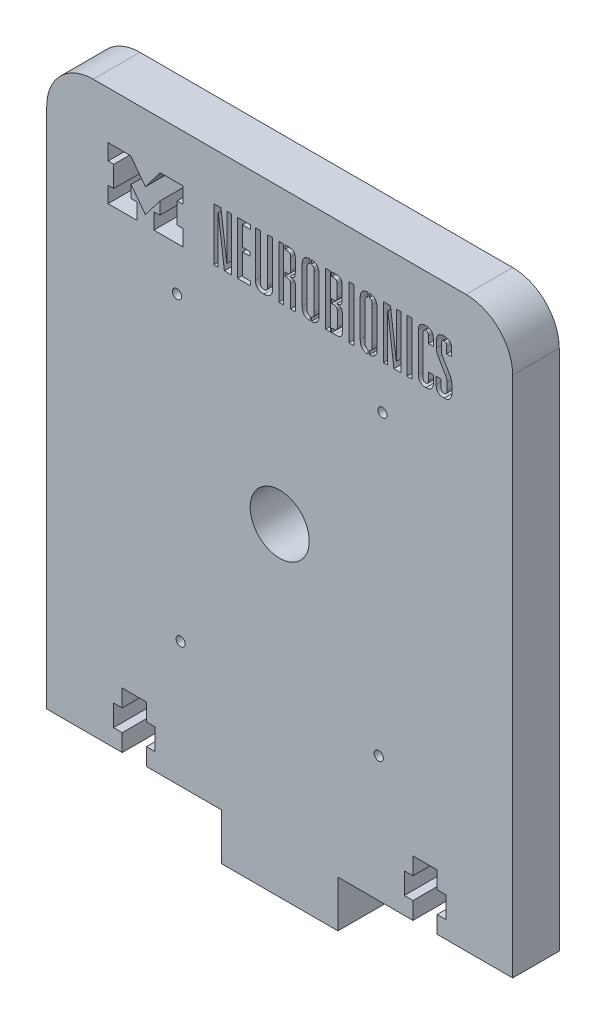
from build123d import *

# Parameters (mm, degrees)
SKETCH1_W             = 127
SKETCH1_H             = 155
BOSS_EXTRUDE1_DEPTH   = 12.7
CUT_EXTRUDE1_DEPTH    = 201.786677845
FILLET1_R             = 12.7
SKETCH11_W            = 31.75
SKETCH11_H            = 12.7
BOSS_EXTRUDE2_DEPTH   = 12.7
CUT_EXTRUDE9_DEPTH    = 201.786677845
SKETCH19_W            = 1.320165
SKETCH19_H            = 14.40446524
CUT_EXTRUDE10_DEPTH   = 201.786677845
SKETCH21_R            = 8.05
CUT_EXTRUDE11_DEPTH   = 201.786677992
M3X0_5_TAPPED_HOLE1_D = 2.5
FILLET2_R             = 0.25


with BuildPart() as part:
    # Sketch1 → Boss-Extrude1 (new body)
    with BuildSketch(Plane.XY):
        with Locations((63.5, 77.5)):
            Rectangle(SKETCH1_W, SKETCH1_H)
    extrude(amount=BOSS_EXTRUDE1_DEPTH)

    # Sketch2 → Cut-Extrude1 (cut, through all)
    with BuildSketch(Plane.XY.offset(12.7)):
        Polygon((20.574, 4.699), (20.574, 0), (27.178, 0), (27.178, 4.699), (29.5402, 4.699), (29.5402, 10.541), (27.178, 10.541), (27.178, 15.24), (20.574, 15.24), (20.574, 10.541), (18.2118, 10.541), (18.2118, 4.699), align=None)
        Polygon((99.822, 4.699), (99.822, 0), (106.426, 0), (106.426, 4.699), (108.7882, 4.699), (108.7882, 10.541), (106.426, 10.541), (106.426, 15.24), (99.822, 15.24), (99.822, 10.541), (97.4598, 10.541), (97.4598, 4.699), align=None)
    extrude(amount=-CUT_EXTRUDE1_DEPTH, mode=Mode.SUBTRACT)

    # Fillet1
    fillet1_edges = [part.edges().sort_by_distance(p)[0] for p in [
        (127, 155, 6.35),
        (0, 155, 6.35),
    ]]
    fillet(fillet1_edges, radius=FILLET1_R)

    # Sketch11 → Boss-Extrude2 (add)
    with BuildSketch(Plane.XZ):
        with Locations((63.5, 6.35)):
            Rectangle(SKETCH11_W, SKETCH11_H)
    extrude(amount=BOSS_EXTRUDE2_DEPTH)

    # Sketch20 → Cut-Extrude9 (cut, through all)
    with BuildSketch(Plane.XY.offset(12.7)):
        Polygon((22.97667018, 131.97336552), (24.604291259, 131.97336552), (24.604291259, 127.640619868), (16.714850296, 127.640619868), (16.714850296, 131.97336552), (18.254329992, 131.97336552), (18.254329992, 137.700621193), (16.714056676, 137.700621193), (16.714056676, 142.045085108), (22.890341603, 142.045085108), (26.901674355, 136.730226684), (30.913007108, 142.045085108), (37.089292035, 142.045085108), (37.089292035, 137.700621193), (35.549018719, 137.700621193), (35.549018719, 131.97336552), (37.088498415, 131.97336552), (37.088498415, 127.640619868), (29.199057452, 127.640619868), (29.199057452, 131.97336552), (30.826678531, 131.97336552), (30.826678531, 135.321098969), (26.901674355, 130.12062252), (22.97667018, 135.321098969), align=None)
    extrude(amount=-CUT_EXTRUDE9_DEPTH, mode=Mode.SUBTRACT)

    # Sketch19 → Cut-Extrude10 (cut, through all)
    with BuildSketch(Plane.XY.offset(12.7)):
        with BuildLine():
            Line((64.919332717, 135.678954152), (64.919332717, 134.564150108))
            Line((64.919332717, 134.564150108), (65.415267123, 134.564150108))
            add(Edge.make_bspline(
                [(66.456730818, 133.684040108), (66.456730818, 134.388128108), (66.031344123, 134.564150108), (65.415267123, 134.564150108)],
                knots=[0, 0, 0, 0, 1, 1, 1, 1], degree=3))
            Line((66.456730818, 133.684040108), (66.442061927, 133.684023484))
            Line((66.442061927, 133.684023484), (66.442061927, 127.640603244))
            Line((66.442061927, 127.640603244), (67.796402522, 127.640603244))
            Line((67.796402522, 127.640603244), (67.796402522, 133.801373244))
            add(Edge.make_bspline(
                [(66.300215522, 135.136207722), (67.238999913, 135.077535482), (67.796402522, 134.7988332), (67.796402522, 133.801373244)],
                knots=[0, 0, 0, 0, 1, 1, 1, 1], degree=3))
            Line((66.300215522, 135.136207722), (66.300215522, 135.180227108))
            add(Edge.make_bspline(
                [(67.737728717, 136.735086152), (67.737728717, 135.620282108), (67.312342022, 135.238899152), (66.300215522, 135.180227108)],
                knots=[0, 0, 0, 0, 1, 1, 1, 1], degree=3))
            Line((67.737728717, 136.735086152), (67.737728717, 140.387545586))
            add(Edge.make_bspline(
                [(65.698807413, 142.045085108), (66.960298022, 142.045085108), (67.737728717, 141.825060346), (67.737728717, 140.387545586)],
                knots=[0, 0, 0, 0, 1, 1, 1, 1], degree=3))
            Line((65.698807413, 142.045085108), (64.919332717, 142.045085108))
            Line((64.919332717, 142.045085108), (64.919332717, 140.930280868))
            Line((64.919332717, 140.930280868), (65.378467238, 140.930280868))
            add(Edge.make_bspline(
                [(66.493273629, 139.947490586), (66.493273629, 140.783592152), (66.053218629, 140.930280868), (65.378467238, 140.930280868)],
                knots=[0, 0, 0, 0, 1, 1, 1, 1], degree=3))
            Line((66.493273629, 139.947490586), (66.493273629, 136.720422346))
            add(Edge.make_bspline(
                [(65.510483738, 135.678954152), (66.126560738, 135.678954152), (66.493273629, 135.854976152), (66.493273629, 136.720422346)],
                knots=[0, 0, 0, 0, 1, 1, 1, 1], degree=3))
            Line((65.510483738, 135.678954152), (64.919332717, 135.678954152))
        make_face()
        Polygon((64.569332717, 140.93031325), (64.569332717, 142.045085108), (63.249167717, 142.045085108), (63.249167717, 127.640619868), (64.569332717, 127.640619868), align=None)
        Polygon((46.761773522, 140.44621763), (46.717770955, 140.44621763), (46.717770955, 127.640619868), (45.558959455, 127.640619868), (45.558959455, 142.045085108), (47.480533151, 142.045085108), (49.094067955, 129.723545108), (49.138070522, 129.723545108), (49.138070522, 142.045085108), (50.296882413, 142.045085108), (50.296882413, 127.640619868), (48.419314217, 127.640619868), align=None)
        with BuildLine():
            Line((58.217872413, 142.045085108), (58.217872413, 130.002247586))
            add(Edge.make_bspline(
                [(58.217872413, 130.002247586), (58.217872413, 128.960784868), (58.555247522, 128.65274363), (59.215330022, 128.65274363)],
                knots=[0, 0, 0, 0, 1, 1, 1, 1], degree=3))
            add(Edge.make_bspline(
                [(59.215330022, 128.65274363), (59.890081413, 128.65274363), (60.212788217, 128.975454346), (60.212788217, 130.002247586)],
                knots=[0, 0, 0, 0, 1, 1, 1, 1], degree=3))
            Line((60.212788217, 130.002247586), (60.212788217, 142.045085108))
            Line((60.212788217, 142.045085108), (61.518284913, 142.045085108))
            Line((61.518284913, 142.045085108), (61.518284913, 129.576861868))
            add(Edge.make_bspline(
                [(61.518284913, 129.576861868), (61.518284913, 127.977994586), (60.315467522, 127.523270108), (59.185993413, 127.523270108)],
                knots=[0, 0, 0, 0, 1, 1, 1, 1], degree=3))
            add(Edge.make_bspline(
                [(59.185993413, 127.523270108), (58.085855913, 127.523270108), (56.897707413, 127.977994586), (56.897707413, 129.576861868)],
                knots=[0, 0, 0, 0, 1, 1, 1, 1], degree=3))
            Line((56.897707413, 129.576861868), (56.897707413, 142.045085108))
            Line((56.897707413, 142.045085108), (58.217872413, 142.045085108))
        make_face()
        with BuildLine():
            Line((74.230211032, 139.727460153), (74.230211032, 129.958239152))
            add(Edge.make_bspline(
                [(74.230211032, 129.958239152), (74.230211032, 128.588188835), (73.727002155, 127.598938483), (72.105088423, 127.527419045)],
                knots=[0, 0, 0, 0, 0.962898501, 0.962898501, 0.962898501, 0.962898501], degree=3))
            Line((72.105088423, 127.527419045), (72.105088423, 128.649158115))
            add(Edge.make_bspline(
                [(72.105088423, 128.649158115), (72.774089716, 128.731143819), (72.910046032, 129.260484228), (72.910046032, 129.987578109)],
                knots=[0.082066912, 0.082066912, 0.082066912, 0.082066912, 1, 1, 1, 1], degree=3))
            Line((72.910046032, 129.987578109), (72.910046032, 139.683457587))
            add(Edge.make_bspline(
                [(72.910046032, 139.683457587), (72.910046032, 140.410551468), (72.774089716, 140.939891712), (72.105088423, 141.021877389)],
                knots=[0, 0, 0, 0, 0.917933088, 0.917933088, 0.917933088, 0.917933088], degree=3))
            Line((72.105088423, 141.021877389), (72.105088423, 142.158285932))
            add(Edge.make_bspline(
                [(72.105088423, 142.158285932), (73.727002155, 142.086766486), (74.230211032, 141.097515931), (74.230211032, 139.727460153)],
                knots=[0.037101499, 0.037101499, 0.037101499, 0.037101499, 1, 1, 1, 1], degree=3))
        make_face()
        Polygon((77.316259413, 134.564150108), (77.316259413, 128.755424108), (77.316259413, 127.640603244), (76.010762717, 127.640603244), (76.010762717, 142.045085108), (77.316259413, 142.045085108), (77.316259413, 140.930280868), (77.316259413, 135.678954152), align=None)
        Polygon((94.625086479, 127.640619868), (92.967546957, 140.44621763), (92.923527571, 140.44621763), (92.923527571, 127.640619868), (91.764715093, 127.640619868), (91.764715093, 142.045085108), (93.686287811, 142.045085108), (95.299824571, 129.723545108), (95.343843957, 129.723545108), (95.343843957, 142.045085108), (96.502656435, 142.045085108), (96.502656435, 127.640619868), align=None)
        with BuildLine():
            Line((104.056932957, 129.547523108), (104.056932957, 131.55710663))
            Line((104.056932957, 131.55710663), (105.377097957, 131.55710663))
            Line((105.377097957, 131.55710663), (105.377097957, 129.503520346))
            add(Edge.make_bspline(
                [(105.377097957, 129.503520346), (105.377097957, 128.286030152), (104.702348717, 127.50860063), (103.323511673, 127.50860063)],
                knots=[0, 0, 0, 0, 1, 1, 1, 1], degree=3))
            add(Edge.make_bspline(
                [(103.323511673, 127.50860063), (101.944668957, 127.50860063), (101.269919717, 128.286030152), (101.269919717, 129.503520346)],
                knots=[0, 0, 0, 0, 1, 1, 1, 1], degree=3))
            Line((101.269919717, 129.503520346), (101.269919717, 140.152851346))
            add(Edge.make_bspline(
                [(101.269919717, 140.152851346), (101.269919717, 141.370335868), (101.944668957, 142.147765586), (103.323511673, 142.147765586)],
                knots=[0, 0, 0, 0, 1, 1, 1, 1], degree=3))
            add(Edge.make_bspline(
                [(103.323511673, 142.147765586), (104.702348717, 142.147765586), (105.377097957, 141.370335868), (105.377097957, 140.152851346)],
                knots=[0, 0, 0, 0, 1, 1, 1, 1], degree=3))
            Line((105.377097957, 140.152851346), (105.377097957, 138.275281586))
            Line((105.377097957, 138.275281586), (104.056932957, 138.275281586))
            Line((104.056932957, 138.275281586), (104.056932957, 140.123512586))
            add(Edge.make_bspline(
                [(104.056932957, 140.123512586), (104.056932957, 140.739589586), (103.836908195, 141.047625152), (103.323511673, 141.047625152)],
                knots=[0, 0, 0, 0, 1, 1, 1, 1], degree=3))
            add(Edge.make_bspline(
                [(103.323511673, 141.047625152), (102.810109479, 141.047625152), (102.590084717, 140.754258868), (102.590084717, 140.123512586)],
                knots=[0, 0, 0, 0, 1, 1, 1, 1], degree=3))
            Line((102.590084717, 140.123512586), (102.590084717, 129.547523108))
            add(Edge.make_bspline(
                [(102.590084717, 129.547523108), (102.590084717, 128.931446108), (102.810109479, 128.623410346), (103.323511673, 128.623410346)],
                knots=[0, 0, 0, 0, 1, 1, 1, 1], degree=3))
            add(Edge.make_bspline(
                [(103.323511673, 128.623410346), (103.836908195, 128.623410346), (104.056932957, 128.91677663), (104.056932957, 129.547523108)],
                knots=[0, 0, 0, 0, 1, 1, 1, 1], degree=3))
        make_face()
        with BuildLine():
            Line((107.533370195, 140.064840346), (107.533370195, 138.553983868))
            add(Edge.make_bspline(
                [(107.533370195, 138.553983868), (107.533370195, 138.099259586), (107.606711717, 137.62986563), (107.826736479, 137.263152152)],
                knots=[0, 0, 0, 0, 1, 1, 1, 1], degree=3))
            Line((107.826736479, 137.263152152), (109.924336673, 133.66937063))
            add(Edge.make_bspline(
                [(109.924336673, 133.66937063), (110.217702957, 133.170643586), (110.408394435, 132.554566586), (110.408394435, 131.90915063)],
                knots=[0, 0, 0, 0, 1, 1, 1, 1], degree=3))
            Line((110.408394435, 131.90915063), (110.408394435, 129.635534108))
            add(Edge.make_bspline(
                [(110.408394435, 129.635534108), (110.408394435, 128.286030152), (109.616295435, 127.523270108), (108.296130435, 127.523270108)],
                knots=[0, 0, 0, 0, 1, 1, 1, 1], degree=3))
            add(Edge.make_bspline(
                [(108.296130435, 127.523270108), (106.843951673, 127.523270108), (106.139863673, 128.183355346), (106.139863673, 129.635534108)],
                knots=[0, 0, 0, 0, 1, 1, 1, 1], degree=3))
            Line((106.139863673, 129.635534108), (106.139863673, 131.615784346))
            Line((106.139863673, 131.615784346), (107.460028673, 131.615784346))
            Line((107.460028673, 131.615784346), (107.460028673, 129.723545108))
            add(Edge.make_bspline(
                [(107.460028673, 129.723545108), (107.460028673, 129.048795868), (107.724061673, 128.65274363), (108.296130435, 128.65274363)],
                knots=[0, 0, 0, 0, 1, 1, 1, 1], degree=3))
            add(Edge.make_bspline(
                [(108.296130435, 128.65274363), (108.838865717, 128.65274363), (109.088229435, 129.048795868), (109.088229435, 129.723545108)],
                knots=[0, 0, 0, 0, 1, 1, 1, 1], degree=3))
            Line((109.088229435, 129.723545108), (109.088229435, 131.73312863))
            add(Edge.make_bspline(
                [(109.088229435, 131.73312863), (109.088229435, 132.231861346), (108.985548957, 132.61323863), (108.706846479, 133.111971346)],
                knots=[0, 0, 0, 0, 1, 1, 1, 1], degree=3))
            Line((108.706846479, 133.111971346), (106.770604479, 136.48572263))
            add(Edge.make_bspline(
                [(106.770604479, 136.48572263), (106.418560479, 137.10179963), (106.213205195, 137.585862868), (106.213205195, 138.319284152)],
                knots=[0, 0, 0, 0, 1, 1, 1, 1], degree=3))
            Line((106.213205195, 138.319284152), (106.213205195, 140.050170868))
            add(Edge.make_bspline(
                [(106.213205195, 140.050170868), (106.213205195, 141.473016346), (106.946626479, 142.162434868), (108.281460957, 142.162434868)],
                knots=[0, 0, 0, 0, 1, 1, 1, 1], degree=3))
            add(Edge.make_bspline(
                [(108.281460957, 142.162434868), (109.762978479, 142.162434868), (110.349722195, 141.458346868), (110.349722195, 140.152851346)],
                knots=[0, 0, 0, 0, 1, 1, 1, 1], degree=3))
            Line((110.349722195, 140.152851346), (110.349722195, 138.319284152))
            Line((110.349722195, 138.319284152), (109.029557195, 138.319284152))
            Line((109.029557195, 138.319284152), (109.029557195, 140.064840346))
            Line((109.029557195, 140.064840346), (109.058890479, 140.064840346))
            add(Edge.make_bspline(
                [(109.058890479, 140.064840346), (109.058890479, 140.62223963), (108.912207435, 141.047625152), (108.296130435, 141.047625152)],
                knots=[0, 0, 0, 0, 1, 1, 1, 1], degree=3))
            add(Edge.make_bspline(
                [(108.296130435, 141.047625152), (107.680053435, 141.047625152), (107.533370195, 140.62223963), (107.533370195, 140.064840346)],
                knots=[0, 0, 0, 0, 1, 1, 1, 1], degree=3))
        make_face()
        with BuildLine():
            Line((85.442609195, 129.958239152), (85.442609195, 139.727460153))
            add(Edge.make_bspline(
                [(85.442609195, 139.727460153), (85.442609195, 141.097515797), (85.945819062, 142.086766292), (87.567728479, 142.158285911)],
                knots=[0, 0, 0, 0, 0.962898407, 0.962898407, 0.962898407, 0.962898407], degree=3))
            Line((87.567728479, 142.158285911), (87.567728479, 141.021877309))
            add(Edge.make_bspline(
                [(87.567728479, 141.021877309), (86.898729931, 140.939891377), (86.762774195, 140.410551237), (86.762774195, 139.683457585)],
                knots=[0.0820672, 0.0820672, 0.0820672, 0.0820672, 1, 1, 1, 1], degree=3))
            Line((86.762774195, 139.683457585), (86.762774195, 129.987578107))
            add(Edge.make_bspline(
                [(86.762774195, 129.987578107), (86.762774195, 129.260484455), (86.898729931, 128.731144151), (87.567728479, 128.649158191)],
                knots=[0, 0, 0, 0, 0.917932799, 0.917932799, 0.917932799, 0.917932799], degree=3))
            Line((87.567728479, 128.649158191), (87.567728479, 127.527419066))
            add(Edge.make_bspline(
                [(87.567728479, 127.527419066), (85.945819062, 127.598938677), (85.442609195, 128.58818897), (85.442609195, 129.958239152)],
                knots=[0.037101593, 0.037101593, 0.037101593, 0.037101593, 1, 1, 1, 1], degree=3))
        make_face()
        with Locations((98.849617217, 134.842852488)):
            Rectangle(SKETCH19_W, SKETCH19_H)
        Polygon((53.318593022, 135.678954152), (55.386851522, 135.678954152), (55.386851522, 134.564150108), (53.318593022, 134.564150108), (53.318593022, 128.755424108), (55.489531413, 128.755424108), (55.489531413, 127.640619868), (51.998428022, 127.640619868), (51.998428022, 142.045085108), (55.489531413, 142.045085108), (55.489531413, 140.930280868), (53.318593022, 140.930280868), align=None)
        with BuildLine():
            Line((80.499323717, 140.387545586), (80.499323717, 136.735086152))
            add(Edge.make_bspline(
                [(80.499323717, 136.735086152), (80.499323717, 135.620282108), (80.073938195, 135.224235346), (79.061810522, 135.180227108)],
                knots=[0, 0, 0, 0, 1, 1, 1, 1], degree=3))
            Line((79.061810522, 135.180227108), (79.061810522, 135.136207722))
            add(Edge.make_bspline(
                [(79.061810522, 135.136207722), (79.985927195, 135.092188336), (80.557995957, 134.7988332), (80.557995957, 133.801373244)],
                knots=[0, 0, 0, 0, 1, 1, 1, 1], degree=3))
            Line((80.557995957, 133.801373244), (80.557995957, 129.298142962))
            add(Edge.make_bspline(
                [(80.557995957, 129.298142962), (80.557995957, 127.860633482), (79.780566435, 127.640603244), (78.460402413, 127.640603244)],
                knots=[0, 0, 0, 0, 1, 1, 1, 1], degree=3))
            Line((78.460402413, 127.640603244), (77.666259413, 127.640603244))
            Line((77.666259413, 127.640603244), (77.666259413, 128.755424108))
            Line((77.666259413, 128.755424108), (78.088026717, 128.755424108))
            add(Edge.make_bspline(
                [(78.088026717, 128.755424108), (78.762777522, 128.755424108), (79.202832522, 128.902107152), (79.202832522, 129.738214586)],
                knots=[0, 0, 0, 0, 1, 1, 1, 1], degree=3))
            Line((79.202832522, 129.738214586), (79.202832522, 133.684040108))
            add(Edge.make_bspline(
                [(79.202832522, 133.684040108), (79.202832522, 134.388128108), (78.777446413, 134.564150108), (78.161369413, 134.564150108)],
                knots=[0, 0, 0, 0, 1, 1, 1, 1], degree=3))
            Line((78.161369413, 134.564150108), (77.666259413, 134.564150108))
            Line((77.666259413, 134.564150108), (77.666259413, 135.678954152))
            Line((77.666259413, 135.678954152), (78.146701108, 135.678954152))
            add(Edge.make_bspline(
                [(78.146701108, 135.678954152), (78.762778108, 135.678954152), (79.129490413, 135.854976152), (79.129490413, 136.720422346)],
                knots=[0, 0, 0, 0, 1, 1, 1, 1], degree=3))
            Line((79.129490413, 136.720422346), (79.129490413, 139.947490586))
            add(Edge.make_bspline(
                [(79.129490413, 139.947490586), (79.129490413, 140.783592152), (78.689435413, 140.930280868), (78.014684608, 140.930280868)],
                knots=[0, 0, 0, 0, 1, 1, 1, 1], degree=3))
            Line((78.014684608, 140.930280868), (77.666259413, 140.930280868))
            Line((77.666259413, 140.930280868), (77.666259413, 142.045085108))
            Line((77.666259413, 142.045085108), (78.460402413, 142.045085108))
            add(Edge.make_bspline(
                [(78.460402413, 142.045085108), (79.721893022, 142.045085108), (80.499323717, 141.825060346), (80.499323717, 140.387545586)],
                knots=[0, 0, 0, 0, 1, 1, 1, 1], degree=3))
        make_face()
        with BuildLine():
            Line((88.722688435, 129.987578107), (88.722688435, 139.683457585))
            add(Edge.make_bspline(
                [(88.722688435, 139.683457585), (88.722688435, 140.410551689), (88.586732366, 140.939892034), (87.917728479, 141.021877462)],
                knots=[0, 0, 0, 0, 0.917933369, 0.917933369, 0.917933369, 0.917933369], degree=3))
            Line((87.917728479, 141.021877462), (87.917728479, 142.158285937))
            add(Edge.make_bspline(
                [(87.917728479, 142.158285937), (89.539643443, 142.086766539), (90.042853435, 141.097515968), (90.042853435, 139.727460153)],
                knots=[0.037101473, 0.037101473, 0.037101473, 0.037101473, 1, 1, 1, 1], degree=3))
            Line((90.042853435, 139.727460153), (90.042853435, 129.958239152))
            add(Edge.make_bspline(
                [(90.042853435, 129.958239152), (90.042853435, 128.588188799), (89.539643443, 127.59893843), (87.917728479, 127.527419039)],
                knots=[0, 0, 0, 0, 0.962898527, 0.962898527, 0.962898527, 0.962898527], degree=3))
            Line((87.917728479, 127.527419039), (87.917728479, 128.649158038))
            add(Edge.make_bspline(
                [(87.917728479, 128.649158038), (88.586732365, 128.731143494), (88.722688435, 129.260484004), (88.722688435, 129.987578107)],
                knots=[0.082066631, 0.082066631, 0.082066631, 0.082066631, 1, 1, 1, 1], degree=3))
        make_face()
        with Locations((83.036976173, 134.842852488)):
            Rectangle(SKETCH19_W, SKETCH19_H)
        with BuildLine():
            Line((70.950130228, 139.683457587), (70.950130228, 129.98757811))
            add(Edge.make_bspline(
                [(70.950130228, 129.98757811), (70.950130228, 129.260484224), (71.086087039, 128.731143814), (71.755088423, 128.649158115)],
                knots=[0, 0, 0, 0, 0.917933093, 0.917933093, 0.917933093, 0.917933093], degree=3))
            Line((71.755088423, 128.649158115), (71.755088423, 127.527419042))
            add(Edge.make_bspline(
                [(71.755088423, 127.527419042), (70.133174118, 127.598938457), (69.629965228, 128.588188818), (69.629965228, 129.958239152)],
                knots=[0.037101486, 0.037101486, 0.037101486, 0.037101486, 1, 1, 1, 1], degree=3))
            Line((69.629965228, 129.958239152), (69.629965217, 139.727460152))
            add(Edge.make_bspline(
                [(69.629965217, 139.727460152), (69.629965217, 141.097515951), (70.13317411, 142.086766515), (71.755088423, 142.158285934)],
                knots=[0, 0, 0, 0, 0.962898516, 0.962898516, 0.962898516, 0.962898516], degree=3))
            Line((71.755088423, 142.158285934), (71.755088423, 141.02187739))
            add(Edge.make_bspline(
                [(71.755088423, 141.02187739), (71.086087039, 140.939891718), (70.950130228, 140.410551472), (70.950130228, 139.683457587)],
                knots=[0.082066907, 0.082066907, 0.082066907, 0.082066907, 1, 1, 1, 1], degree=3))
        make_face()
    extrude(amount=-CUT_EXTRUDE10_DEPTH, mode=Mode.SUBTRACT)

    # Sketch21 → Cut-Extrude11 (cut, through all)
    with BuildSketch(Plane.XY.offset(12.7)):
        with Locations((63.5, 75.3825868)):
            Circle(SKETCH21_R)
    extrude(amount=-CUT_EXTRUDE11_DEPTH, mode=Mode.SUBTRACT)

    # M3x0.5 Tapped Hole1 (through all)
    with Locations(Plane.XY.offset(12.7)):
        with Locations((35.50000012, 115.720694002), (36.5, 34.21)):
            m3x0_5_tapped_hole1 = Hole(M3X0_5_TAPPED_HOLE1_D / 2)

    # Mirror3: M3x0.5 Tapped Hole1 across plane
    add(m3x0_5_tapped_hole1.mirror(Plane(origin=(63.5, 0, 0), x_dir=(0, 0, 1), z_dir=(1, 0, 0))), mode=Mode.SUBTRACT)

    # Fillet2
    fillet2_edges = [part.edges().sort_by_distance(p)[0] for p in [
        (24.604291259, 131.97336552, 6.35),
        (29.199057452, 131.97336552, 6.35),
    ]]
    fillet(fillet2_edges, radius=FILLET2_R)


solid = part.part
